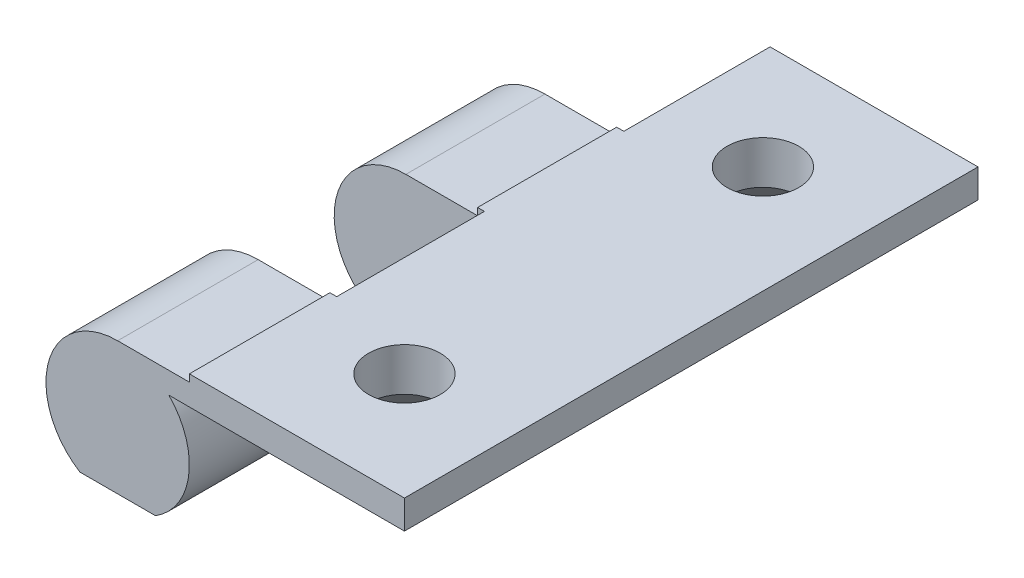
from build123d import *
from build123d.topology import SkipClean

# Parameters (mm, degrees)
IZIM1_R                     = 3.5
Y_KSEKLIK_EKSTR_ZYON1_DEPTH = 40
KES_EKSTR_ZYON1_DEPTH       = 46.058295574
KES_EKSTR_ZYON1_DEPTH_BACK  = 46.058295574
IZIM3_W                     = 10
IZIM3_H                     = 10
KES_EKSTR_ZYON2_DEPTH       = 46.771852704
IZIM5_R                     = 2.5
KES_EKSTR_ZYON4_DEPTH       = 46
PAH1_SIZE                   = 3
IZIM4_W                     = 0.5
IZIM4_H                     = 10
KES_EKSTR_ZYON5_DEPTH       = 46
PAH2_SIZE                   = 2
BOSS_EXTRUDE1_START         = -10
SKETCH1_R                   = 3.5
BOSS_EXTRUDE1_DEPTH         = 10
BOSS_EXTRUDE2_START         = -10
SKETCH2_R                   = 3.5
BOSS_EXTRUDE2_DEPTH         = 10
CUT_EXTRUDE1_DEPTH          = 0.2
CUT_EXTRUDE2_DEPTH          = 0.2
CUT_EXTRUDE3_START          = -0.1
CUT_EXTRUDE3_DEPTH          = 0.1


with BuildPart() as part:
    # Çizim1 → Yükseklik-Ekstrüzyon1 (new body)
    with BuildSketch(Plane.XY):
        with BuildLine():
            Line((0, 5), (5, 5))
            Line((5, 5), (5, 5.5))
            Line((5, 5.5), (20, 5.5))
            Line((20, 5.5), (20, 5))
            Line((20, 5), (20, 0.5))
            Line((20, 0.5), (4.974937186, 0.5))
            ThreePointArc((4.974937186, 0.5), (-3.354101966, -3.708099244), (0, 5))
        make_face()
        Circle(IZIM1_R, mode=Mode.SUBTRACT)
    extrude(amount=Y_KSEKLIK_EKSTR_ZYON1_DEPTH)

    # Çizim2 → Kes-Ekstrüzyon1 (cut, two sides: drawn at the far end of the back side and taken through both)
    with BuildSketch(Plane.XY.offset(40).offset(-KES_EKSTR_ZYON1_DEPTH_BACK)):
        Polygon((-72.503925857, -4.25), (-6.336762511, -4.25), (12.42239056, -4.25), (78.589553905, -4.25), (78.589553905, -136.584326691), (-72.503925857, -136.584326691), align=None)
    extrude(amount=KES_EKSTR_ZYON1_DEPTH + KES_EKSTR_ZYON1_DEPTH_BACK, mode=Mode.SUBTRACT)

    # Çizim3 → Kes-Ekstrüzyon2 (cut, through all)
    with BuildSketch(Plane.XZ.offset(4.25)):
        with Locations((0, 25)):
            Rectangle(IZIM3_W, IZIM3_H)
        with Locations((0, 5)):
            Rectangle(IZIM3_W, IZIM3_H)
    extrude(amount=-KES_EKSTR_ZYON2_DEPTH, mode=Mode.SUBTRACT)

    # Çizim5 → Kes-Ekstrüzyon4 (cut, through all)
    with BuildSketch(Plane.XZ.offset(-0.5)):
        with Locations(Location((12.5, 7.5, 0), (0, 0, 270))):
            Circle(IZIM5_R)
        with Locations(Location((12.5, 32.5, 0), (0, 0, 90))):
            Circle(IZIM5_R)
    extrude(amount=-KES_EKSTR_ZYON4_DEPTH, mode=Mode.SUBTRACT)

    # Pah1
    pah1_edges = [part.edges().sort_by_distance(p)[0] for p in [
        (20, 0.5, 20),
        (12.487468593, 0.5, 40),
        (12.5, 0.5, 0),
    ]]
    chamfer(pah1_edges, length=PAH1_SIZE)

    # Çizim4 → Kes-Ekstrüzyon5 (cut, through all)
    with BuildSketch(Plane.XZ.offset(-0.5)):
        with Locations((5.224937186, 25)):
            Rectangle(IZIM4_W, IZIM4_H)
        with Locations((5.25, 5)):
            Rectangle(IZIM4_W, IZIM4_H)
    extrude(amount=-KES_EKSTR_ZYON5_DEPTH, mode=Mode.SUBTRACT)

    # Pah2
    pah2_edges = [part.edges().sort_by_distance(p)[0] for p in [
        (12.5, 0.5, 10),
        (12.5, 0.5, 30),
    ]]
    chamfer(pah2_edges, length=PAH2_SIZE - 0.0001)  # a hair under: the kernel refuses the full size

    # Sketch1 → Boss-Extrude1 (add)
    with BuildSketch(Plane.XY.offset(40).offset(BOSS_EXTRUDE1_START)):
        with Locations(Location((0, 0, 0), (0, 0, 180))):
            Circle(SKETCH1_R)
    extrude(amount=BOSS_EXTRUDE1_DEPTH)

    # Sketch2 → Boss-Extrude2 (add)
    with BuildSketch(Plane.XY.offset(20).offset(BOSS_EXTRUDE2_START)):
        Circle(SKETCH2_R)
    extrude(amount=BOSS_EXTRUDE2_DEPTH)

    # Sketch3 → Cut-Extrude1 (cut)
    with BuildSketch(Plane(origin=(0, 0, 30), x_dir=(-1, 0, 0), z_dir=(0, 0, -1))):
        with BuildLine():
            Line((0, 5), (-5, 5))
            Line((-5, 5), (-5, 5.5))
            Line((-5, 5.5), (-5.474937186, 5.5))
            Line((-5.474937186, 5.5), (-5.474937186, 0.5))
            Line((-5.474937186, 0.5), (-4.974937186, 0.5))
            ThreePointArc((-4.974937186, 0.5), (-4.484894308, -2.210367175), (-2.633913438, -4.25))
            Line((-2.633913438, -4.25), (2.633913438, -4.25))
            ThreePointArc((2.633913438, -4.25), (4.808846015, 1.369306394), (0, 5))
        make_face()
    extrude(amount=-CUT_EXTRUDE1_DEPTH, mode=Mode.SUBTRACT)

    # Sketch4 → Cut-Extrude2 (cut)
    with BuildSketch(Plane(origin=(0, 0, 10), x_dir=(-1, 0, 0), z_dir=(0, 0, -1))):
        with BuildLine():
            Line((-2.633913438, -4.25), (2.633913438, -4.25))
            ThreePointArc((2.633913438, -4.25), (4.808846015, 1.369306394), (0, 5))
            Line((0, 5), (-5, 5))
            Line((-5, 5), (-5, 5.5))
            Line((-5, 5.5), (-5.5, 5.5))
            Line((-5.5, 5.5), (-5.5, 0.5))
            Line((-5.5, 0.5), (-4.974937186, 0.5))
            ThreePointArc((-4.974937186, 0.5), (-4.484894308, -2.210367175), (-2.633913438, -4.25))
        make_face()
    extrude(amount=-CUT_EXTRUDE2_DEPTH, mode=Mode.SUBTRACT)

    # Sketch5 → Cut-Extrude3 (cut)
    with BuildSketch(Plane.XY.offset(20).offset(CUT_EXTRUDE3_START)):
        with BuildLine():
            Line((4.974937186, 0.5), (5.474937186, 0.5))
            Line((5.474937186, 0.5), (5.474937186, 5.5))
            Line((5.474937186, 5.5), (5, 5.5))
            Line((5, 5.5), (5, 5))
            Line((5, 5), (0, 5))
            ThreePointArc((0, 5), (-4.808846015, 1.369306394), (-2.633913438, -4.25))
            Line((-2.633913438, -4.25), (2.633913438, -4.25))
            ThreePointArc((2.633913438, -4.25), (4.484894308, -2.210367175), (4.974937186, 0.5))
        make_face()
    extrude(amount=CUT_EXTRUDE3_DEPTH, mode=Mode.SUBTRACT)

    # Sketch6 → Revolve1 (revolve)
    with BuildSketch(Plane(origin=(0, 0.375, 0), x_dir=(-1, 0, 0), z_dir=(0, -1, 0)), mode=Mode.PRIVATE) as revolve1_sk:
        with BuildLine():
            ThreePointArc((0, -7.2), (-3, -10.2), (0, -13.2))
            Line((0, -13.2), (0, -7.2))
        make_face()
        with BuildLine():
            Line((0, -7.2), (0, -13.2))
            ThreePointArc((0, -13.2), (2.121320344, -12.321320344), (3, -10.2))
            ThreePointArc((3, -10.2), (2.121320344, -8.078679656), (0, -7.2))
        make_face()
    revolve(revolve1_sk.sketch.rotate(Axis((0, 0.375, 13.2), (0, 0, -1)), 180), axis=Axis((0, 0.375, 13.2), (0, 0, -1)))

    # Sketch6<7> → Cut-Revolve1 (revolve, cut)
    with SkipClean():  # the faces are left unmerged after this step: merging them gives an invalid solid
        with BuildSketch(Plane(origin=(0, 0.375, 0), x_dir=(-1, 0, 0), z_dir=(0, -1, 0)), mode=Mode.PRIVATE) as cut_revolve1_sk:
            with BuildLine():
                ThreePointArc((0, -27.2), (-3, -30.2), (0, -33.2))
                Line((0, -33.2), (0, -27.2))
            make_face()
            with BuildLine():
                Line((0, -27.2), (0, -33.2))
                ThreePointArc((0, -33.2), (2.121320344, -32.321320344), (3, -30.2))
                ThreePointArc((3, -30.2), (2.121320344, -28.078679656), (0, -27.2))
            make_face()
        revolve(cut_revolve1_sk.sketch.rotate(Axis((0, 0.375, 33.2), (0, 0, -1)), 180), axis=Axis((0, 0.375, 33.2), (0, 0, -1)), mode=Mode.SUBTRACT)
    add(part.part.scale(1), mode=Mode.REPLACE)  # the faces are merged on a copy


solid = part.part
